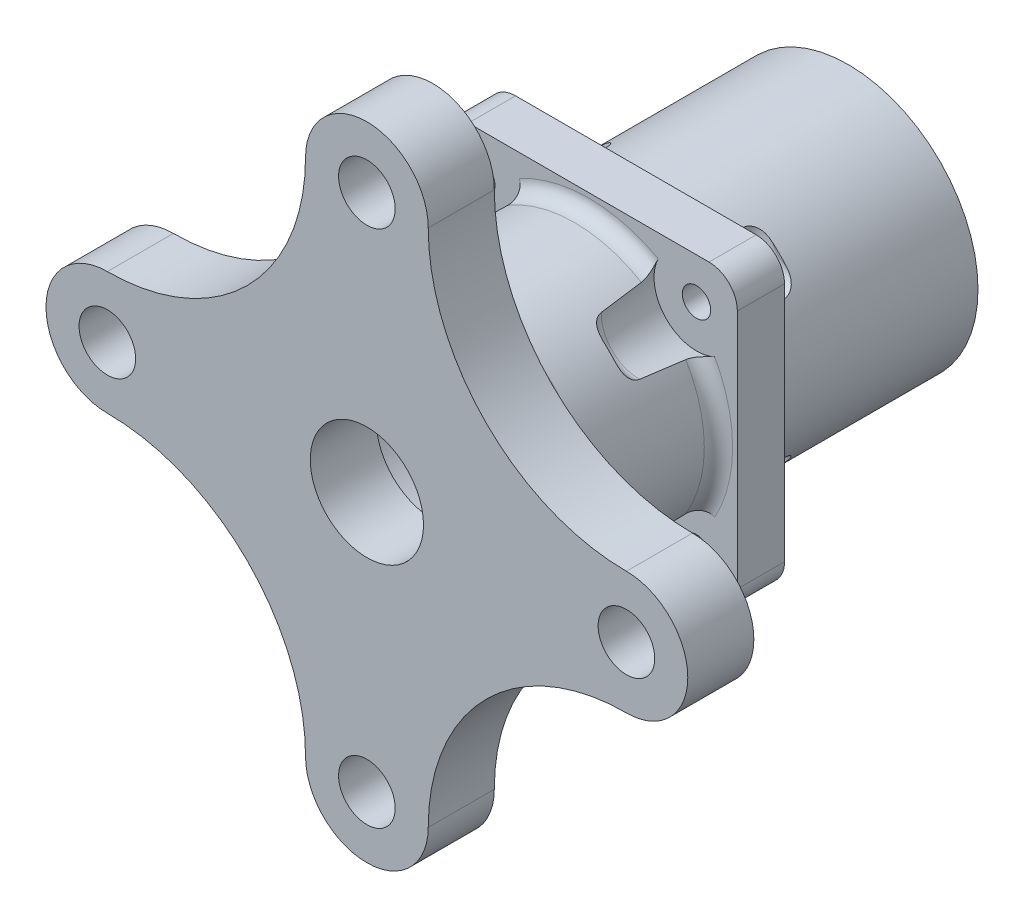
from build123d import *

# Parameters (mm, degrees)
SKETCH1_R                    = 27.5
SKETCH1_R_2                  = 20
BOSS_EXTRUDE1_DEPTH          = 88
SKETCH2_R                    = 3
SKETCH2_R_2                  = 27.5
BOSS_EXTRUDE2_DEPTH          = 10
SKETCH3_R                    = 6
SKETCH3_R_2                  = 12
BOSS_EXTRUDE3_DEPTH          = 14
SKETCH4_R                    = 9
CUT_EXTRUDE1_DEPTH           = 11
CUT_EXTRUDE1_DRAFT           = 5
CUT_EXTRUDE1_PROFILE_2_DEPTH = 11
CUT_EXTRUDE1_PROFILE_2_DRAFT = 5
CUT_EXTRUDE1_PROFILE_3_DEPTH = 11
CUT_EXTRUDE1_PROFILE_3_DRAFT = 5
CUT_EXTRUDE1_PROFILE_4_DEPTH = 11
CUT_EXTRUDE1_PROFILE_4_DRAFT = 5
SKETCH5_R                    = 9
CUT_EXTRUDE2_DEPTH           = 15
CUT_EXTRUDE2_DRAFT           = 5
CUT_EXTRUDE2_PROFILE_2_DEPTH = 15
CUT_EXTRUDE2_PROFILE_2_DRAFT = 5
CUT_EXTRUDE2_PROFILE_3_DEPTH = 15
CUT_EXTRUDE2_PROFILE_3_DRAFT = 5
CUT_EXTRUDE2_PROFILE_4_DEPTH = 15
CUT_EXTRUDE2_PROFILE_4_DRAFT = 5
FILLET1_R                    = 3
FILLET2_R                    = 3
FILLET3_R                    = 6


with BuildPart() as part:
    # Sketch1 → Boss-Extrude1 (new body)
    with BuildSketch(Plane.XY):
        Circle(SKETCH1_R)
        Circle(SKETCH1_R_2, mode=Mode.SUBTRACT)
    extrude(amount=BOSS_EXTRUDE1_DEPTH)

    # Sketch2 → Boss-Extrude2 (add)
    with BuildSketch(Plane(origin=(0, 0, 45), x_dir=(-1, 0, 0), z_dir=(0, 0, -1))):
        with BuildLine():
            Line((-25.5, -31.5), (25.5, -31.5))
            ThreePointArc((25.5, -31.5), (29.742640687, -29.742640687), (31.5, -25.5))
            Line((31.5, -25.5), (31.5, 25.5))
            ThreePointArc((31.5, 25.5), (29.742640687, 29.742640687), (25.5, 31.5))
            Line((25.5, 31.5), (-25.5, 31.5))
            ThreePointArc((-25.5, 31.5), (-29.742640687, 29.742640687), (-31.5, 25.5))
            Line((-31.5, 25.5), (-31.5, -25.5))
            ThreePointArc((-31.5, -25.5), (-29.742640687, -29.742640687), (-25.5, -31.5))
        make_face()
        with Locations((22.8466201, 22.8466201)):
            Circle(SKETCH2_R, mode=Mode.SUBTRACT)
        with Locations((-22.8466201, -22.8466201)):
            Circle(SKETCH2_R, mode=Mode.SUBTRACT)
        with Locations((22.8466201, -22.8466201)):
            Circle(SKETCH2_R, mode=Mode.SUBTRACT)
        with Locations((-22.8466201, 22.8466201)):
            Circle(SKETCH2_R, mode=Mode.SUBTRACT)
        Circle(SKETCH2_R_2, mode=Mode.SUBTRACT)
    extrude(amount=-BOSS_EXTRUDE2_DEPTH)

    # Sketch3 → Boss-Extrude3 (add)
    with BuildSketch(Plane.XY.offset(88)):
        with BuildLine():
            ThreePointArc((55, 13), (25.30151519, 25.30151519), (13, 55))
            ThreePointArc((13, 55), (0, 68), (-13, 55))
            ThreePointArc((-13, 55), (-25.30151519, 25.30151519), (-55, 13))
            ThreePointArc((-55, 13), (-68, 0), (-55, -13))
            ThreePointArc((-55, -13), (-25.30151519, -25.30151519), (-13, -55))
            ThreePointArc((-13, -55), (0, -68), (13, -55))
            ThreePointArc((13, -55), (25.30151519, -25.30151519), (55, -13))
            ThreePointArc((55, -13), (68, 0), (55, 13))
        make_face()
        with Locations((0, -55)):
            Circle(SKETCH3_R, mode=Mode.SUBTRACT)
        with Locations((-55, 0)):
            Circle(SKETCH3_R, mode=Mode.SUBTRACT)
        with Locations((55, 0)):
            Circle(SKETCH3_R, mode=Mode.SUBTRACT)
        with Locations((0, 55)):
            Circle(SKETCH3_R, mode=Mode.SUBTRACT)
        Circle(SKETCH3_R_2, mode=Mode.SUBTRACT)
    extrude(amount=BOSS_EXTRUDE3_DEPTH)


with BuildPart() as cut_extrude1_tool:
    # Sketch4 → Cut-Extrude1 (with draft: the straight prism first)
    with BuildSketch(Plane(origin=(0, 0, 45), x_dir=(-1, 0, 0), z_dir=(0, 0, -1))):
        with Locations((22.8466201, 22.8466201)):
            Circle(SKETCH4_R)
    extrude(amount=CUT_EXTRUDE1_DEPTH)
    # Cut-Extrude1: the draft: its side faces are tilted about the plane it starts from
    cut_extrude1_sides = [cut_extrude1_tool.faces().sort_by_distance(p)[0] for p in [
        (-13.8466201, 22.8466201, 39.5),
    ]]
    draft(cut_extrude1_sides, Plane(origin=(0, 0, 45), x_dir=(-1, 0, 0), z_dir=(0, 0, -1)), CUT_EXTRUDE1_DRAFT)


with BuildPart() as part_1:
    add(part.part)

    # Cut-Extrude1: cut by cut_extrude1_tool
    add(cut_extrude1_tool.part, mode=Mode.SUBTRACT)


with BuildPart() as cut_extrude1_profile_2_tool:
    # Sketch4 → Cut-Extrude1 profile 2 (with draft: the straight prism first)
    with BuildSketch(Plane(origin=(0, 0, 45), x_dir=(-1, 0, 0), z_dir=(0, 0, -1))):
        with Locations((22.8466201, -22.8466201)):
            Circle(SKETCH4_R)
    extrude(amount=CUT_EXTRUDE1_PROFILE_2_DEPTH)
    # Cut-Extrude1 profile 2: the draft: its side faces are tilted about the plane it starts from
    cut_extrude1_profile_2_sides = [cut_extrude1_profile_2_tool.faces().sort_by_distance(p)[0] for p in [
        (-13.8466201, -22.8466201, 39.5),
    ]]
    draft(cut_extrude1_profile_2_sides, Plane(origin=(0, 0, 45), x_dir=(-1, 0, 0), z_dir=(0, 0, -1)), CUT_EXTRUDE1_PROFILE_2_DRAFT)


with BuildPart() as part_2:
    add(part_1.part)

    # Cut-Extrude1 profile 2: cut by cut_extrude1_profile_2_tool
    add(cut_extrude1_profile_2_tool.part, mode=Mode.SUBTRACT)


with BuildPart() as cut_extrude1_profile_3_tool:
    # Sketch4 → Cut-Extrude1 profile 3 (with draft: the straight prism first)
    with BuildSketch(Plane(origin=(0, 0, 45), x_dir=(-1, 0, 0), z_dir=(0, 0, -1))):
        with Locations((-22.8466201, -22.8466201)):
            Circle(SKETCH4_R)
    extrude(amount=CUT_EXTRUDE1_PROFILE_3_DEPTH)
    # Cut-Extrude1 profile 3: the draft: its side faces are tilted about the plane it starts from
    cut_extrude1_profile_3_sides = [cut_extrude1_profile_3_tool.faces().sort_by_distance(p)[0] for p in [
        (31.8466201, -22.8466201, 39.5),
    ]]
    draft(cut_extrude1_profile_3_sides, Plane(origin=(0, 0, 45), x_dir=(-1, 0, 0), z_dir=(0, 0, -1)), CUT_EXTRUDE1_PROFILE_3_DRAFT)


with BuildPart() as part_3:
    add(part_2.part)

    # Cut-Extrude1 profile 3: cut by cut_extrude1_profile_3_tool
    add(cut_extrude1_profile_3_tool.part, mode=Mode.SUBTRACT)


with BuildPart() as cut_extrude1_profile_4_tool:
    # Sketch4 → Cut-Extrude1 profile 4 (with draft: the straight prism first)
    with BuildSketch(Plane(origin=(0, 0, 45), x_dir=(-1, 0, 0), z_dir=(0, 0, -1))):
        with Locations((-22.8466201, 22.8466201)):
            Circle(SKETCH4_R)
    extrude(amount=CUT_EXTRUDE1_PROFILE_4_DEPTH)
    # Cut-Extrude1 profile 4: the draft: its side faces are tilted about the plane it starts from
    cut_extrude1_profile_4_sides = [cut_extrude1_profile_4_tool.faces().sort_by_distance(p)[0] for p in [
        (31.8466201, 22.8466201, 39.5),
    ]]
    draft(cut_extrude1_profile_4_sides, Plane(origin=(0, 0, 45), x_dir=(-1, 0, 0), z_dir=(0, 0, -1)), CUT_EXTRUDE1_PROFILE_4_DRAFT)


with BuildPart() as part_4:
    add(part_3.part)

    # Cut-Extrude1 profile 4: cut by cut_extrude1_profile_4_tool
    add(cut_extrude1_profile_4_tool.part, mode=Mode.SUBTRACT)


with BuildPart() as cut_extrude2_tool:
    # Sketch5 → Cut-Extrude2 (with draft: the straight prism first)
    with BuildSketch(Plane.XY.offset(55)):
        with Locations((22.8466201, 22.8466201)):
            Circle(SKETCH5_R)
    extrude(amount=CUT_EXTRUDE2_DEPTH)
    # Cut-Extrude2: the draft: its side faces are tilted about the plane it starts from
    cut_extrude2_sides = [cut_extrude2_tool.faces().sort_by_distance(p)[0] for p in [
        (13.8466201, 22.8466201, 62.5),
    ]]
    draft(cut_extrude2_sides, Plane.XY.offset(55), CUT_EXTRUDE2_DRAFT)


with BuildPart() as part_5:
    add(part_4.part)

    # Cut-Extrude2: cut by cut_extrude2_tool
    add(cut_extrude2_tool.part, mode=Mode.SUBTRACT)


with BuildPart() as cut_extrude2_profile_2_tool:
    # Sketch5 → Cut-Extrude2 profile 2 (with draft: the straight prism first)
    with BuildSketch(Plane.XY.offset(55)):
        with Locations((22.8466201, -22.8466201)):
            Circle(SKETCH5_R)
    extrude(amount=CUT_EXTRUDE2_PROFILE_2_DEPTH)
    # Cut-Extrude2 profile 2: the draft: its side faces are tilted about the plane it starts from
    cut_extrude2_profile_2_sides = [cut_extrude2_profile_2_tool.faces().sort_by_distance(p)[0] for p in [
        (13.8466201, -22.8466201, 62.5),
    ]]
    draft(cut_extrude2_profile_2_sides, Plane.XY.offset(55), CUT_EXTRUDE2_PROFILE_2_DRAFT)


with BuildPart() as part_6:
    add(part_5.part)

    # Cut-Extrude2 profile 2: cut by cut_extrude2_profile_2_tool
    add(cut_extrude2_profile_2_tool.part, mode=Mode.SUBTRACT)


with BuildPart() as cut_extrude2_profile_3_tool:
    # Sketch5 → Cut-Extrude2 profile 3 (with draft: the straight prism first)
    with BuildSketch(Plane.XY.offset(55)):
        with Locations((-22.8466201, -22.8466201)):
            Circle(SKETCH5_R)
    extrude(amount=CUT_EXTRUDE2_PROFILE_3_DEPTH)
    # Cut-Extrude2 profile 3: the draft: its side faces are tilted about the plane it starts from
    cut_extrude2_profile_3_sides = [cut_extrude2_profile_3_tool.faces().sort_by_distance(p)[0] for p in [
        (-31.8466201, -22.8466201, 62.5),
    ]]
    draft(cut_extrude2_profile_3_sides, Plane.XY.offset(55), CUT_EXTRUDE2_PROFILE_3_DRAFT)


with BuildPart() as part_7:
    add(part_6.part)

    # Cut-Extrude2 profile 3: cut by cut_extrude2_profile_3_tool
    add(cut_extrude2_profile_3_tool.part, mode=Mode.SUBTRACT)


with BuildPart() as cut_extrude2_profile_4_tool:
    # Sketch5 → Cut-Extrude2 profile 4 (with draft: the straight prism first)
    with BuildSketch(Plane.XY.offset(55)):
        with Locations((-22.8466201, 22.8466201)):
            Circle(SKETCH5_R)
    extrude(amount=CUT_EXTRUDE2_PROFILE_4_DEPTH)
    # Cut-Extrude2 profile 4: the draft: its side faces are tilted about the plane it starts from
    cut_extrude2_profile_4_sides = [cut_extrude2_profile_4_tool.faces().sort_by_distance(p)[0] for p in [
        (-31.8466201, 22.8466201, 62.5),
    ]]
    draft(cut_extrude2_profile_4_sides, Plane.XY.offset(55), CUT_EXTRUDE2_PROFILE_4_DRAFT)


with BuildPart() as part_8:
    add(part_7.part)

    # Cut-Extrude2 profile 4: cut by cut_extrude2_profile_4_tool
    add(cut_extrude2_profile_4_tool.part, mode=Mode.SUBTRACT)

    # Fillet1
    fillet1_edges = [part_8.edges().sort_by_distance(p)[0] for p in [
        (17.163161169, 17.163161169, 34),
        (-17.410616478, -17.410616478, 70),
        (17.410616478, -17.410616478, 70),
        (17.410616478, 17.410616478, 70),
        (-17.410616478, 17.410616478, 70),
        (-17.163161169, 17.163161169, 34),
        (-17.163161169, -17.163161169, 34),
        (17.163161169, -17.163161169, 34),
    ]]
    fillet(fillet1_edges, radius=FILLET1_R)

    # Fillet2
    fillet2_edges = [part_8.edges().sort_by_distance(p)[0] for p in [
        (0, 27.5, 55),
        (-27.5, 0, 55),
        (0, -27.5, 55),
        (26.541816869, -7.195968128, 55),
        (-27.5, 0, 45),
        (0, 27.5, 45),
        (0, -27.5, 45),
        (26.541816869, -7.195968128, 45),
    ]]
    fillet(fillet2_edges, radius=FILLET2_R)

    # Fillet3
    fillet3_edges = [part_8.edges().sort_by_distance(p)[0] for p in [
        (-27.5, 0, 88),
    ]]
    fillet(fillet3_edges, radius=FILLET3_R)


solid = part_8.part
